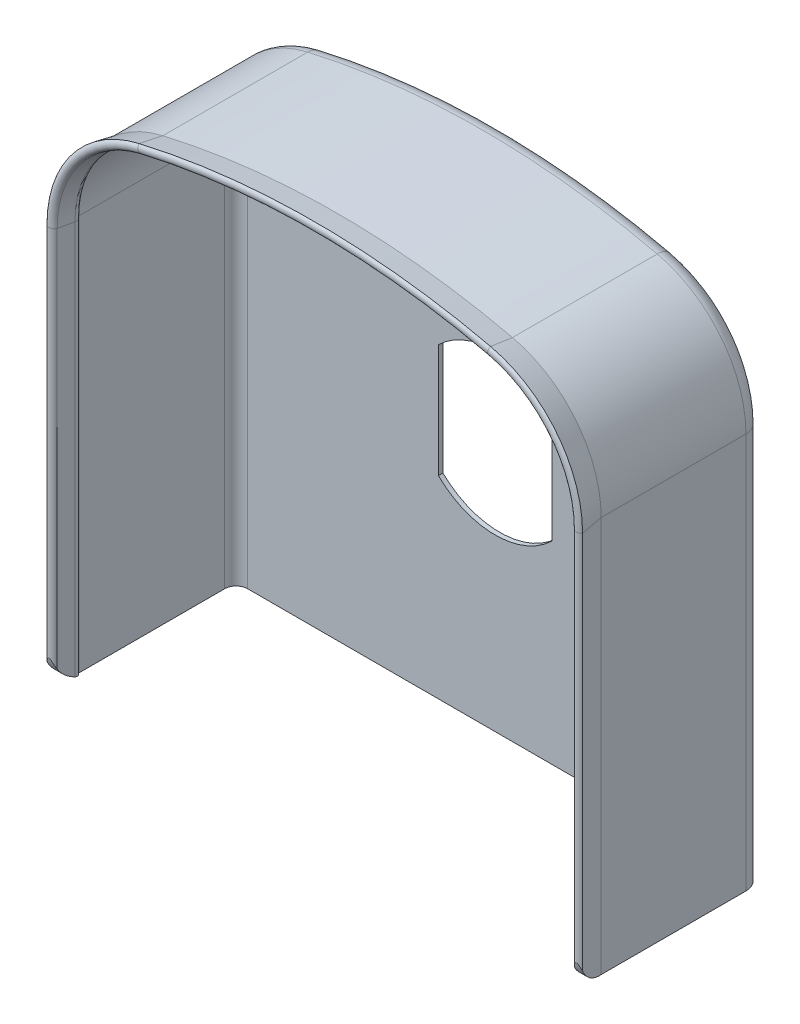
from build123d import *

# Parameters (mm, degrees)
ESBO_O4_W                  = 92
ESBO_O4_H                  = 99.397000359
RESSALTO_EXTRUS_O2_DEPTH   = 0.8
CORTE_EXTRUS_O1_START      = -1
CORTE_EXTRUS_O1_DEPTH      = 1
CORTE_EXTRUS_O2_DEPTH      = 136.212783118
FILETE8_R                  = 1
CORTE_EXTRUS_O4_DEPTH      = 136.212783118
CORTE_EXTRUS_O4_DEPTH_BACK = 136.212783118
FILETE10_R                 = 2
FILETE11_R                 = 3


with BuildPart() as part:
    # Varredura1: sweep along a path in Esboço1
    with BuildLine(Plane.XY) as varredura1_path:
        Line((0, 0), (0, 69.096427937))
        ThreePointArc((0, 69.096427937), (-4.342158003, 81.53957802), (-15.483198399, 88.579715732))
        ThreePointArc((-15.483198399, 88.579715732), (-46, 92.070770961), (-76.516801601, 88.579715732))
        ThreePointArc((-76.516801601, 88.579715732), (-87.657841997, 81.53957802), (-92, 69.096427937))
        Line((-92, 69.096427937), (-92, 0))
    # Esboço2 → Varredura1 (sweep)
    with BuildSketch(Plane(origin=(0, 0, 0), x_dir=(1, 0, 0), z_dir=(0, 1, 0))):
        with BuildLine():
            Line((-0.8, -28.273328944), (-0.09293029, -32.044242141))
            Line((-0.09293029, -32.044242141), (-0.830714704, -28.401410992))
            Line((-0.830714704, -28.401410992), (-1.53336923, -28.543719964))
            Line((-1.53336923, -28.543719964), (-0.8, -32.044242141))
            ThreePointArc((-0.8, -32.044242141), (-0.092135156, -32.613021625), (0.75, -32.273328944))
            Line((0.75, -32.273328944), (0, -28.273328944))
            Line((0, -28.273328944), (0, 0))
            Line((0, 0), (-0.8, 0))
            Line((-0.8, 0), (-0.8, -28.273328944))
        make_face()
    sweep(path=varredura1_path.line)

    # Esboço4 → Ressalto-extrusão2 (add)
    with BuildSketch(Plane(origin=(0, 0, 0), x_dir=(-1, 0, 0), z_dir=(0, 0, -1))):
        with Locations((46, 49.69850018)):
            Rectangle(ESBO_O4_W, ESBO_O4_H)
    extrude(amount=-RESSALTO_EXTRUS_O2_DEPTH)

    # Esboço6 → Corte-extrusão1 (cut)
    with BuildSketch(Plane.XY.offset(0.8).offset(CORTE_EXTRUS_O1_START)):
        with BuildLine():
            Line((-92, 69.096427937), (-92, 105.833978266))
            Line((-92, 105.833978266), (0, 105.833978266))
            Line((0, 105.833978266), (0, 69.096427937))
            ThreePointArc((0, 69.096427937), (-4.342158003, 81.53957802), (-15.483198399, 88.579715732))
            ThreePointArc((-15.483198399, 88.579715732), (-46, 92.070770961), (-76.516801601, 88.579715732))
            ThreePointArc((-76.516801601, 88.579715732), (-87.657841997, 81.53957802), (-92, 69.096427937))
        make_face()
    extrude(amount=CORTE_EXTRUS_O1_DEPTH, mode=Mode.SUBTRACT)

    # Esboço7 → Corte-extrusão2 (cut, through all)
    with BuildSketch(Plane(origin=(0, 0, 0), x_dir=(-1, 0, 0), z_dir=(0, 0, -1))):
        with BuildLine():
            Line((55.9, 53.55), (55.9, 33.75))
            ThreePointArc((55.9, 33.75), (46, 29.734257245), (36.1, 33.75))
            Line((36.1, 33.75), (36.1, 53.55))
            ThreePointArc((36.1, 53.55), (46, 57.565742755), (55.9, 53.55))
        make_face()
    extrude(amount=-CORTE_EXTRUS_O2_DEPTH, mode=Mode.SUBTRACT)

    # Filete8
    # the kernel refuses this fillet: 1 mm, written as the material it takes off along each edge
    with BuildSketch(Plane(origin=(-46, -43.054940969, 28.543719964), x_dir=(0.22584008006616485, 0.9741643897390769, 0), z_dir=(0.9741643897390769, -0.22584008006616485, 0))) as filete8_piece_1:
        with BuildLine():
            CenterArc((134.768740044, 0.738354268), FILETE8_R, 168.167507323, 73.554966167)
            Line((133.789988783, 0.943405407), (133.770413758, 0.947506429))
            Line((133.770413758, 0.947506429), (133.572767675, 0.004101023))
            Line((133.572767675, 0.004101023), (133.588372694, -0.019602016))
            ThreePointArc((133.588372694, -0.019602016), (133.939699957, -0.090756503), (134.28552237, -0.159922237))
            Line((134.28552237, -0.159922237), (134.294997227, -0.142308972))
        make_face()
    revolve(axis=Axis((-46, -43.054940969, 28.543719964), (0, 0, 1)), revolution_arc=26.104565599, mode=Mode.SUBTRACT)
    with BuildSketch(Plane(origin=(-72, 69.096427937, 28.543719964), x_dir=(-0.2258400800661638, 0.9741643897390773, 0), z_dir=(0.9741643897390773, 0.2258400800661638, 0))) as filete8_piece_2:
        with BuildLine():
            CenterArc((19.643028114, 0.738354268), FILETE8_R, 168.167507323, 73.554966167)
            Line((19.169285296, -0.142308972), (19.15981044, -0.159922237))
            ThreePointArc((19.15981044, -0.159922237), (18.813988027, -0.090756503), (18.462660764, -0.019602016))
            Line((18.462660764, -0.019602016), (18.447055745, 0.004101023))
            Line((18.447055745, 0.004101023), (18.644701828, 0.947506429))
            Line((18.644701828, 0.947506429), (18.664276853, 0.943405407))
        make_face()
    revolve(axis=Axis((-72, 69.096427937, 28.543719964), (0, 0, 1)), revolution_arc=76.9477172, mode=Mode.SUBTRACT)
    with BuildSketch(Plane(origin=(-90.46663077, 69.096427937, 28.543719964), x_dir=(-0.20505113872706254, 0, 0.9787512607944548), z_dir=(0, -1, 0))) as filete8_piece_3:
        with BuildLine():
            CenterArc((0.963886786, 1), FILETE8_R, 196.445033833, 73.554966167)
            Line((0.004795025, 0.716904621), (-0.014386811, 0.711242713))
            ThreePointArc((-0.014386811, 0.711242713), (-0.01760204, 0.358586078), (-0.019999553, 0.000133767))
            Line((-0.019999553, 0.000133767), (0, -0.02))
            Line((0, -0.02), (0.963886786, -0.02))
            Line((0.963886786, -0.02), (0.963886786, 0))
        make_face()
    extrude(amount=71.506144901, mode=Mode.SUBTRACT)
    with BuildSketch(Plane(origin=(-20, 69.096427937, 28.543719964), x_dir=(1, 0, 0), z_dir=(0, -1, 0))) as filete8_piece_4:
        with BuildLine():
            CenterArc((19.643028114, 0.738354268), FILETE8_R, 168.167507323, 73.554966167)
            Line((18.664276853, 0.943405407), (18.644701828, 0.947506429))
            Line((18.644701828, 0.947506429), (18.447055745, 0.004101023))
            Line((18.447055745, 0.004101023), (18.462660764, -0.019602016))
            ThreePointArc((18.462660764, -0.019602016), (18.813988027, -0.090756503), (19.15981044, -0.159922237))
            Line((19.15981044, -0.159922237), (19.169285296, -0.142308972))
        make_face()
    revolve(axis=Axis((-20, 69.096427937, 28.543719964), (0, 0, 1)), revolution_arc=76.9477172, mode=Mode.SUBTRACT)
    with BuildSketch(Plane(origin=(-1.53336923, -2.409716964, 28.543719964), x_dir=(0.9801008248789868, 0, -0.19850031000361154), z_dir=(0, 1, 0))) as filete8_piece_5:
        with BuildLine():
            CenterArc((1.006424456, -0.957176864), FILETE8_R, 106.828251577, 73.554966167)
            Line((0.006446823, -0.963865226), (-0.013552729, -0.963998993))
            Line((-0.013552729, -0.963998993), (-0.019999553, -0.000133767))
            Line((-0.019999553, -0.000133767), (0, 0.02))
            ThreePointArc((0, 0.02), (0.358460328, 0.02), (0.71113058, 0.019143537))
            Line((0.71113058, 0.019143537), (0.716920656, 0))
        make_face()
    extrude(amount=71.506144901, mode=Mode.SUBTRACT)

    # Esboço8 → Corte-extrusão4 (cut, two sides: drawn at the far end of the back side and taken through both)
    with BuildSketch(Plane(origin=(0, 0, 0), x_dir=(0, 0, -1), z_dir=(1, 0, 0)).offset(-CORTE_EXTRUS_O4_DEPTH_BACK)):
        with BuildLine():
            Line((-14.136664472, 0), (-28.273328944, 0))
            ThreePointArc((-28.273328944, 0), (-31.102110178, 1.288762683), (-32.622670844, 4))
            Line((-32.622670844, 4), (-38.469837325, 4))
            Line((-38.469837325, 4), (-38.469837325, -4.573477319))
            Line((-38.469837325, -4.573477319), (-14.136664472, -4.573477319))
            Line((-14.136664472, -4.573477319), (-14.136664472, 0))
        make_face()
    extrude(amount=CORTE_EXTRUS_O4_DEPTH + CORTE_EXTRUS_O4_DEPTH_BACK, mode=Mode.SUBTRACT)

    # Filete10
    filete10_edges = [part.edges().sort_by_distance(p)[0] for p in [
        (-0.8, 34.548213968, 0.8),
        (-91.2, 34.548213968, 0.8),
        (-87.031528317, 81.041852016, 0.8),
        (-46, 91.270770961, 0.8),
        (-4.968471683, 81.041852016, 0.8),
    ]]
    fillet(filete10_edges, radius=FILETE10_R)

    # Filete11
    filete11_edges = [part.edges().sort_by_distance(p)[0] for p in [
        (0, 34.548213968, 0),
        (-92, 34.548213968, 0),
        (-87.657841997, 81.53957802, 0),
        (-4.342158003, 81.53957802, 0),
        (-46, 92.070770961, 0),
    ]]
    fillet(filete11_edges, radius=FILETE11_R)


solid = part.part
